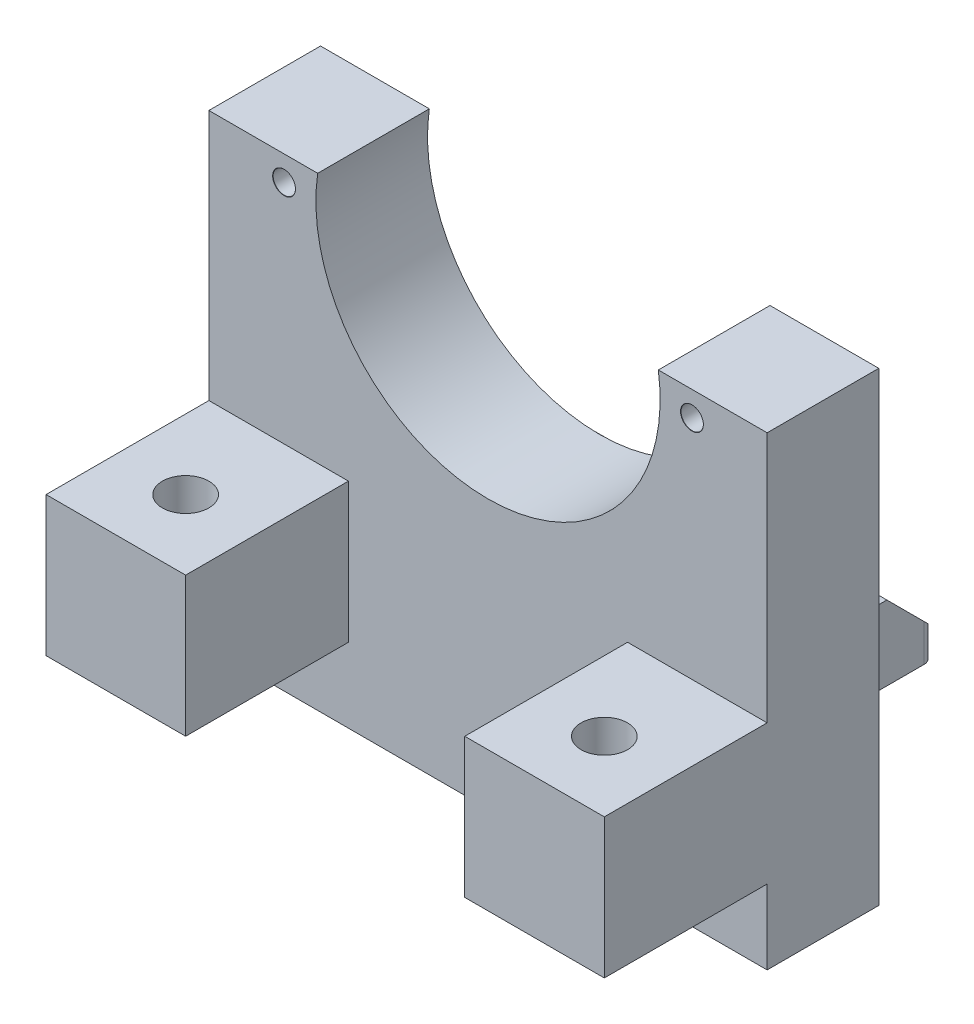
from build123d import *

# Parameters (mm, degrees)
SKETCH8_W                      = 40
SKETCH8_H                      = 19.5
BOSS_EXTRUDE1_DEPTH            = 8
SKETCH16_W                     = 40
SKETCH16_H                     = 8
BOSS_EXTRUDE2_DEPTH            = 17.87
CHAMFER2_SIZE                  = 5
FILLET1_R                      = 1
CBORE_FOR_M3_SHCS2_AT_2_COUNT  = 2
CBORE_FOR_M3_SHCS2_AT_2_PITCH  = 16
SKETCH19_W                     = 40
SKETCH19_H                     = 8
BOSS_EXTRUDE3_DEPTH            = 0.5
BOSS_EXTRUDE4_DEPTH            = 12
M2_CLEARANCE_HOLE1_D           = 2.4
M2_CLEARANCE_HOLE1_CSINK_D     = 2.45
M2_CLEARANCE_HOLE1_CSINK_ANGLE = 90
SKETCH26_R                     = 18.5
CUT_EXTRUDE2_DEPTH             = 75.391779788
SKETCH34_W                     = 15
SKETCH34_H                     = 15
BOSS_EXTRUDE5_DEPTH            = 17.5
SKETCH35_R                     = 2.5
CUT_EXTRUDE3_DEPTH             = 15
BOSS_EXTRUDE6_DEPTH            = 4


with BuildPart() as part:
    # Sketch8 → Boss-Extrude1 (new body)
    with BuildSketch(Plane(origin=(0, 0, 0), x_dir=(1, 0, 0), z_dir=(0, 1, 0))):
        Rectangle(SKETCH8_W, SKETCH8_H)
    extrude(amount=BOSS_EXTRUDE1_DEPTH)

    # Sketch16 → Boss-Extrude2 (add)
    with BuildSketch(Plane(origin=(0, 0, -9.75), x_dir=(-1, 0, 0), z_dir=(0, 0, -1))):
        with Locations((0, 4)):
            Rectangle(SKETCH16_W, SKETCH16_H)
    extrude(amount=BOSS_EXTRUDE2_DEPTH)

    # Chamfer2
    chamfer2_edges = [part.edges().sort_by_distance(p)[0] for p in [
        (0, 8, -27.62),
    ]]
    chamfer(chamfer2_edges, length=CHAMFER2_SIZE)

    # Fillet1
    fillet1_edges = [part.edges().sort_by_distance(p)[0] for p in [
        (-20, 1.5, -27.62),
        (20, 1.5, -27.62),
    ]]
    fillet(fillet1_edges, radius=FILLET1_R)

    # Sketch18 → CBORE for M3 SHCS2 (revolve, cut)
    with BuildSketch(Plane(origin=(-8, 8, -8), x_dir=(0, 0, 1), z_dir=(1, 0, 0))):
        Polygon((0, 0), (0, 8), (1.7, 8), (1.7, 3), (3.25, 3), (3.25, 0.025), (3.275, 0), align=None)
    cbore_for_m3_shcs2 = revolve(axis=Axis((-8, 14.35, -8), (0, -1, 0)), mode=Mode.SUBTRACT)

    # CBORE for M3 SHCS2 at 2: CBORE for M3 SHCS2 ×2
    with Locations(*[(i * CBORE_FOR_M3_SHCS2_AT_2_PITCH, 0, 0) for i in range(1, CBORE_FOR_M3_SHCS2_AT_2_COUNT)]):
        add(cbore_for_m3_shcs2, mode=Mode.SUBTRACT)

    # Sketch19 → Boss-Extrude3 (add)
    with BuildSketch(Plane.XY.offset(9.75)):
        with Locations((0, 4)):
            Rectangle(SKETCH19_W, SKETCH19_H)
    extrude(amount=BOSS_EXTRUDE3_DEPTH)

    # Sketch20 → Boss-Extrude4 (add)
    with BuildSketch(Plane.XY.offset(10.25)):
        Polygon((0, 0), (40, 0), (40, 50), (-20, 50), (-20, 0), align=None)
    extrude(amount=-BOSS_EXTRUDE4_DEPTH)

    # M2 Clearance Hole1 (through all)
    with Locations(Plane.XY.offset(10.25)):
        with Locations((-11.92, 47.34), (31.92, 47.34)):
            CounterSinkHole(M2_CLEARANCE_HOLE1_D / 2, M2_CLEARANCE_HOLE1_CSINK_D / 2, counter_sink_angle=M2_CLEARANCE_HOLE1_CSINK_ANGLE)

    # Sketch26 → Cut-Extrude2 (cut, through all)
    with BuildSketch(Plane.XY.offset(10.25)):
        with Locations((10, 47.34)):
            Circle(SKETCH26_R)
    extrude(amount=-CUT_EXTRUDE2_DEPTH, mode=Mode.SUBTRACT)

    # Sketch34 → Boss-Extrude5 (add)
    with BuildSketch(Plane.XY.offset(10.25)):
        with Locations((-12.5, 15.5)):
            Rectangle(SKETCH34_W, SKETCH34_H)
        with Locations((32.5, 15.5)):
            Rectangle(SKETCH34_W, SKETCH34_H)
    extrude(amount=BOSS_EXTRUDE5_DEPTH)

    # Sketch35 → Cut-Extrude3 (cut)
    with BuildSketch(Plane(origin=(0, 23, 0), x_dir=(1, 0, 0), z_dir=(0, 1, 0))):
        with Locations((-12.5, -20.25)):
            Circle(SKETCH35_R)
        with Locations((32.5, -20.25)):
            Circle(SKETCH35_R)
    extrude(amount=-CUT_EXTRUDE3_DEPTH, mode=Mode.SUBTRACT)

    # Sketch36 → Boss-Extrude6 (add, symmetric)
    with BuildSketch(Plane(origin=(0, 0, 0), x_dir=(0, 0, -1), z_dir=(1, 0, 0))):
        Polygon((1.75, 28.87), (1.75, 8), (22.62, 8), align=None)
    extrude(amount=BOSS_EXTRUDE6_DEPTH, both=True)


solid = part.part
